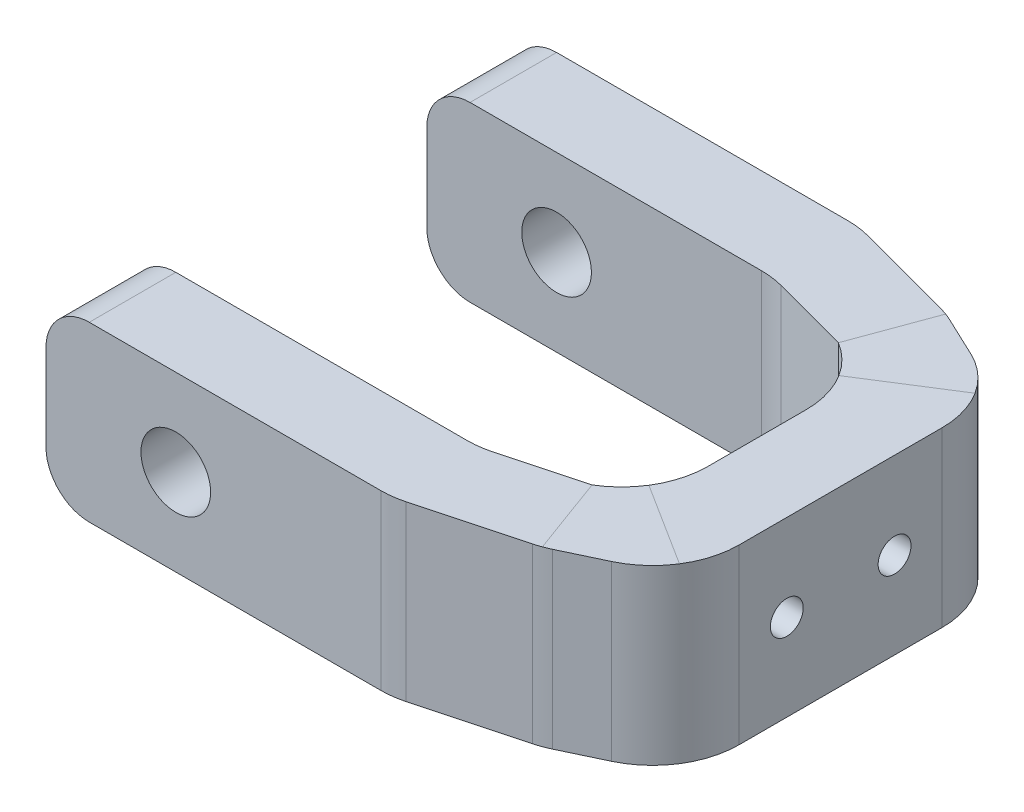
from build123d import *

# Parameters (mm, degrees)
SKETCH4_R                      = 4.025
BOSS_EXTRUDE1_DEPTH            = 10
SWEEP2_START                   = -10
SWEEP2_DEPTH                   = 20
CUT_EXTRUDE2_REACH             = 58.724
BOSS_EXTRUDE2_DEPTH            = 20
CUT_EXTRUDE3_REACH             = 69.223
SKETCH4_10_R                   = 4.025
CUT_EXTRUDE3_DIRECTION_2_DEPTH = 68.223447839
FILLET4_R                      = 10
F_6_CLEARANCE_HOLE1_D          = 3.7973


with BuildPart() as part:
    # Sketch4 → Boss-Extrude1 (new body)
    # profile 1 of 2: a face of its own
    with BuildSketch(Plane.XY):
        with BuildLine():
            Line((-10, 10), (25, 10))
            Line((25, 10), (25, -10))
            Line((25, -10), (-10, -10))
            ThreePointArc((-10, -10), (-13.535533906, -8.535533906), (-15, -5))
            Line((-15, -5), (-15, 5))
            ThreePointArc((-15, 5), (-13.535533906, 8.535533906), (-10, 10))
        make_face()
        Circle(SKETCH4_R, mode=Mode.SUBTRACT)
    # profile 2 of 2: a face of its own
    with BuildSketch(Plane.XY):
        Circle(SKETCH4_R)
    extrude(amount=-BOSS_EXTRUDE1_DEPTH)

    # Sweep2: read off the stored shape, not the designer's step
    # Sweep2 outline → Sweep2 (add)
    with BuildSketch(Plane(origin=(0, 0, 0), x_dir=(1, 0, 0), z_dir=(0, 1, 0)).offset(SWEEP2_START)):
        Polygon((40.170370869, -5.058020855), (40.170370869, -18.294095226), (49.829629131, -15.705904774), (49.829629131, 1.058020855), (38.67117676, 6.336819228), (25, 10), (25, 0), (35.32882324, -2.767599846), align=None)
    extrude(amount=SWEEP2_DEPTH)

    # Sketch18 → Cut-Extrude2 (cut, up to next)
    with BuildSketch(Plane(origin=(0, 10, 0), x_dir=(1, 0, 0), z_dir=(0, 1, 0)), mode=Mode.PRIVATE) as cut_extrude2_sk1:
        Polygon((40.170370869, -18.294095226), (45, -17), (40.170370869, -17), align=None)
    cut_extrude2_tool1 = extrude(cut_extrude2_sk1.sketch, amount=-CUT_EXTRUDE2_REACH, mode=Mode.PRIVATE) & part.part
    add(cut_extrude2_tool1.solids().sort_by_distance((41.780247, 10, 17.431365))[0], mode=Mode.SUBTRACT)

    # Sketch18<3> → Boss-Extrude2 (add, through all)
    with BuildSketch(Plane(origin=(0, 10, 0), x_dir=(1, 0, 0), z_dir=(0, 1, 0))):
        Polygon((49.829629131, -17), (49.829629131, -15.705904774), (45, -17), align=None)
    extrude(amount=-BOSS_EXTRUDE2_DEPTH)

    # Mirror1: part across face


with BuildPart() as part_1:
    add(part.part)
    add(part.part.mirror(Plane(origin=(45, 0, 17), x_dir=(1, 0, 0), z_dir=(0, 0, 1))))

    # Sketch4<10> → Cut-Extrude3 (cut, up to next)
    with BuildSketch(Plane.XY, mode=Mode.PRIVATE) as cut_extrude3_sk1:
        with Locations(Location((0, 0, 0), (0, 0, 180))):
            Circle(SKETCH4_10_R)
    cut_extrude3_tool1 = extrude(cut_extrude3_sk1.sketch, amount=-CUT_EXTRUDE3_REACH, mode=Mode.PRIVATE) & part_1.part
    add(cut_extrude3_tool1.solids().sort_by_distance((0, 0, 0))[0], mode=Mode.SUBTRACT)

    # Sketch4<10> → Cut-Extrude3 direction 2 (cut)
    with BuildSketch(Plane.XY):
        with Locations(Location((0, 0, 0), (0, 0, 180))):
            Circle(SKETCH4_10_R)
    extrude(amount=CUT_EXTRUDE3_DIRECTION_2_DEPTH, mode=Mode.SUBTRACT)

    # Fillet4
    # the kernel refuses this fillet: 10 mm, written as the material it adds along each edge
    with BuildSketch(Plane(origin=(25, 10, 34), x_dir=(-1, 0, 0), z_dir=(0, -1, 0))) as fillet4_piece_1:
        with BuildLine():
            CenterArc((FILLET4_R * 0.131652497591, FILLET4_R), FILLET4_R, 255, 15)
            Line((-FILLET4_R * 0.127166547518, FILLET4_R * 0.0340741737128), (0, 0))
            Line((0, 0), (FILLET4_R * 0.131652497591, 0))
        make_face()
    extrude(amount=20)
    with BuildSketch(Plane(origin=(25, 10, 0), x_dir=(-1, 0, 0), z_dir=(0, -1, 0))) as fillet4_piece_2:
        with BuildLine():
            CenterArc((FILLET4_R * 0.131652497591, -FILLET4_R), FILLET4_R, 90, 15)
            Line((-FILLET4_R * 0.127166547518, -FILLET4_R * 0.0340741737128), (0, 0))
            Line((0, 0), (FILLET4_R * 0.131652497591, 0))
        make_face()
    extrude(amount=20)
    with BuildSketch(Plane(origin=(40.170370869, -10, 5.058020855), x_dir=(0, 0, 1), z_dir=(0, 1, 0))) as fillet4_piece_3:
        with BuildLine():
            CenterArc((6.276396903, -10), FILLET4_R, 90, 58.94603144)
            Line((-2.290421009, -4.841547629), (0, 0))
            Line((0, 0), (6.276396903, 0))
        make_face()
    extrude(amount=20)
    with BuildSketch(Plane(origin=(40.170370869, -10, 28.941979145), x_dir=(-0.90395035591234, 0, 0.4276374095492042), z_dir=(0, 1, 0))) as fillet4_piece_4:
        with BuildLine():
            CenterArc((6.355481446, -9.94992531), FILLET4_R, 95.736251166, 58.94603144)
            Line((-2.684022113, -5.673551214), (0, 0))
            Line((0, 0), (5.355988409, 0))
        make_face()
    extrude(amount=20)
    # the kernel refuses this fillet: 10 mm, written as the material it takes off along each edge
    with BuildSketch(Plane(origin=(49.829629131, -25.829480752, -1.058020855), x_dir=(-0.9039503558586357, 0, -0.4276374096627259), z_dir=(0, 1, 0)), Plane(origin=(49.829629131, -25.829480752, 35.058020855), x_dir=(0, 0, -1), z_dir=(0, 1, 0))) as fillet4_2_piece_1:
        with BuildLine():
            CenterArc((FILLET4_R * 0.633179230062, FILLET4_R), FILLET4_R, 205.317717401, 64.682282599)
            Line((-FILLET4_R * 0.270771125796, FILLET4_R * 0.572362590337), (0, 0))
            Line((0, 0), (FILLET4_R * 0.633179230062, 0))
        make_face()
    extrude(amount=51.658961503, mode=Mode.SUBTRACT)
    with BuildSketch(Plane(origin=(38.67117676, -12.257079455, -6.336819228), x_dir=(0.9039503558586354, 0, 0.42763740966272634), z_dir=(0, 1, 0))) as fillet4_2_piece_2:
        with BuildLine():
            CenterArc((FILLET4_R * 0.0902831782122, -FILLET4_R), FILLET4_R, 90, 10.317717402)
            Line((-FILLET4_R * 0.0888232721735, -FILLET4_R * 0.0161702995791), (0, 0))
            Line((0, 0), (FILLET4_R * 0.0902831782122, 0))
        make_face()
    extrude(amount=24.514158911, mode=Mode.SUBTRACT)
    with BuildSketch(Plane(origin=(25, 13.291312439, -10), x_dir=(-1, 0, 0), z_dir=(0, -1, 0)), Plane(origin=(25, 13.291312439, 44), x_dir=(0.9659258262965777, 0, -0.2588190450744948), z_dir=(0, -1, 0))) as fillet4_2_piece_3:
        with BuildLine():
            CenterArc((FILLET4_R * 0.131652497573, -FILLET4_R), FILLET4_R, 90, 14.999999998)
            Line((-FILLET4_R * 0.127166547502, -FILLET4_R * 0.0340741737034), (0, 0))
            Line((0, 0), (FILLET4_R * 0.131652497573, 0))
        make_face()
    extrude(amount=26.582624879, mode=Mode.SUBTRACT)
    with BuildSketch(Plane(origin=(38.67117676, -12.257079455, 40.336819228), x_dir=(0.9039503558586373, 0, -0.42763740966272235), z_dir=(0, 1, 0))) as fillet4_2_piece_4:
        with BuildLine():
            CenterArc((FILLET4_R * 0.0902831782122, FILLET4_R), FILLET4_R, 259.682282598, 10.317717402)
            Line((-FILLET4_R * 0.0888232721735, FILLET4_R * 0.0161702995791), (0, 0))
            Line((0, 0), (FILLET4_R * 0.0902831782122, 0))
        make_face()
    extrude(amount=24.514158911, mode=Mode.SUBTRACT)

    # #6 Clearance Hole1 (through all)
    with Locations(Plane(origin=(49.829629131, 0, 0), x_dir=(0, 0, -1), z_dir=(1, 0, 0))):
        with Locations((-10.773771446, 0), (-23.226228554, 0)):
            Hole(F_6_CLEARANCE_HOLE1_D / 2)


solid = part_1.part
